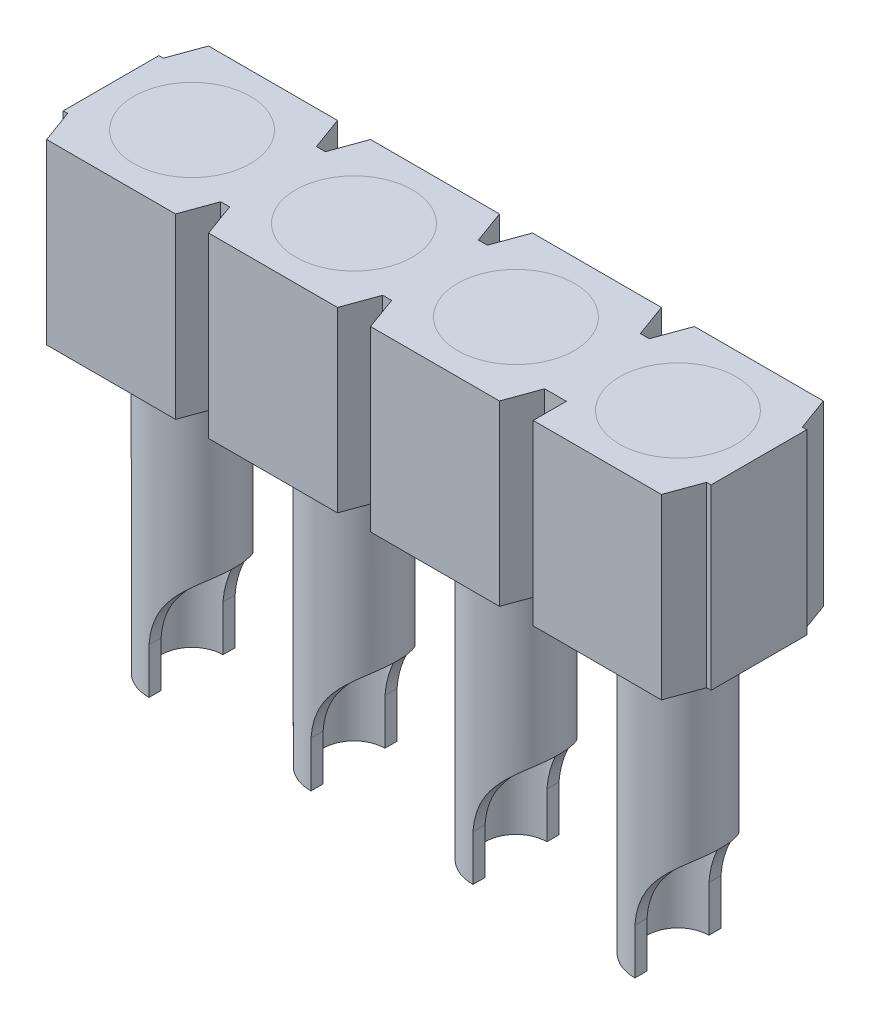
from build123d import *

# Parameters (mm, degrees)
SKETCH1_R              = 0.675
BOSS_EXTRUDE1_DEPTH    = 2.79
CHAMFER3_SIZE          = 0.2
CHAMFER3_SIZE_2        = 0.549495484
SKETCH2_R              = 0.915
CUT_EXTRUDE1_DEPTH     = 0.5
SKETCH3_R              = 0.915
BOSS_EXTRUDE2_DEPTH    = 0.5
SKETCH4_R              = 0.675
BOSS_EXTRUDE3_DEPTH    = 6.87
SKETCH5_R              = 0.485
CUT_EXTRUDE2_DEPTH     = 2.29
CUT_EXTRUDE3_DEPTH     = 5.919573152
LPATTERN1_START        = 2.29
LPATTERN1_OUTLINE_R    = 0.915
LPATTERN1_DEPTH        = 0.5
LPATTERN1_2_OUTLINE_R  = 0.915
LPATTERN1_2_DEPTH      = 0.5
LPATTERN1_3_OUTLINE_R  = 0.675
LPATTERN1_3_DEPTH      = 2.29
LPATTERN1_4_OUTLINE_R  = 0.915
LPATTERN1_4_DEPTH      = 0.5
LPATTERN1_START_2      = -2.29
LPATTERN1_5_OUTLINE_R  = 0.675
LPATTERN1_5_DEPTH      = 4.58
LPATTERN1_START_3      = -4.58
LPATTERN1_6_DEPTH      = 2.29
LPATTERN1_START_4      = -2.814094852
LPATTERN1_7_DEPTH      = 0.524094852
LPATTERN1_START_5      = -3.863768611
LPATTERN1_8_DEPTH      = 1.049673759
LPATTERN1_START_6      = -2
LPATTERN1_9_DEPTH      = 4
LPATTERN1_10_OUTLINE_R = 0.675
LPATTERN1_10_DEPTH     = 4.58
LPATTERN1_11_DEPTH     = 2.29
LPATTERN1_12_DEPTH     = 0.524094852
LPATTERN1_13_DEPTH     = 1.049673759
LPATTERN1_14_DEPTH     = 4
LPATTERN1_15_OUTLINE_R = 0.915
LPATTERN1_15_DEPTH     = 0.5
LPATTERN1_16_OUTLINE_R = 0.675
LPATTERN1_16_DEPTH     = 4.58
LPATTERN1_17_DEPTH     = 2.29
LPATTERN1_18_DEPTH     = 0.524094852
LPATTERN1_19_DEPTH     = 1.049673759
LPATTERN1_20_DEPTH     = 4
SCALE1_SCALE           = 0.7


with BuildPart() as part:
    # Sketch1 → Boss-Extrude1 (new body)
    with BuildSketch(Plane(origin=(0, 0, 0), x_dir=(1, 0, 0), z_dir=(0, 1, 0))):
        Polygon((1, 1.27), (-1, 1.27), (-1, 0.75), (-1.27, 0.75), (-1.27, -0.75), (-1, -0.75), (-1, -1.27), (1, -1.27), (1, -0.75), (1.27, -0.75), (1.27, 0.75), (1, 0.75), align=None)
        with Locations(Location((0, 0, 0), (0, 0, 270))):
            Circle(SKETCH1_R, mode=Mode.SUBTRACT)
    extrude(amount=BOSS_EXTRUDE1_DEPTH)

    # Chamfer3
    # the kernel refuses this chamfer: 0.549495484, 0.2 mm, written as the material it adds along each edge
    with BuildSketch(Plane(origin=(1, 0, -0.75), x_dir=(1, 0, 0), z_dir=(0, 1, 0))) as chamfer3_piece_1_section:
        Polygon((CHAMFER3_SIZE, 0), (0, CHAMFER3_SIZE_2), (0, 0), align=None)
    chamfer3_piece_1 = extrude(amount=2.79, mode=Mode.PRIVATE)
    chamfer3_piece_1 = split(chamfer3_piece_1, bisect_by=Plane(origin=(1, 0, -1.27), z_dir=(0, 0, 1)), keep=Keep.TOP, mode=Mode.PRIVATE)
    add(chamfer3_piece_1)
    with BuildSketch(Plane(origin=(-1, 0, -0.75), x_dir=(0, 0, -1), z_dir=(0, 1, 0))) as chamfer3_piece_2_section:
        Polygon((CHAMFER3_SIZE_2, 0), (0, CHAMFER3_SIZE), (0, 0), align=None)
    chamfer3_piece_2 = extrude(amount=2.79, mode=Mode.PRIVATE)
    chamfer3_piece_2 = split(chamfer3_piece_2, bisect_by=Plane(origin=(-1, 0, -1.27), z_dir=(0, 0, 1)), keep=Keep.TOP, mode=Mode.PRIVATE)
    add(chamfer3_piece_2)
    with BuildSketch(Plane(origin=(-1, 0, 0.75), x_dir=(-1, 0, 0), z_dir=(0, 1, 0))) as chamfer3_piece_3_section:
        Polygon((CHAMFER3_SIZE, 0), (0, CHAMFER3_SIZE_2), (0, 0), align=None)
    chamfer3_piece_3 = extrude(amount=2.79, mode=Mode.PRIVATE)
    chamfer3_piece_3 = split(chamfer3_piece_3, bisect_by=Plane(origin=(-1, 0, 1.27), z_dir=(0, 0, -1)), keep=Keep.TOP, mode=Mode.PRIVATE)
    add(chamfer3_piece_3)
    with BuildSketch(Plane(origin=(1, 0, 0.75), x_dir=(0, 0, 1), z_dir=(0, 1, 0))) as chamfer3_piece_4_section:
        Polygon((CHAMFER3_SIZE_2, 0), (0, CHAMFER3_SIZE), (0, 0), align=None)
    chamfer3_piece_4 = extrude(amount=2.79, mode=Mode.PRIVATE)
    chamfer3_piece_4 = split(chamfer3_piece_4, bisect_by=Plane(origin=(1, 0, 1.27), z_dir=(0, 0, -1)), keep=Keep.TOP, mode=Mode.PRIVATE)
    add(chamfer3_piece_4)

    # Sketch2 → Cut-Extrude1 (cut)
    with BuildSketch(Plane(origin=(0, 2.79, 0), x_dir=(1, 0, 0), z_dir=(0, 1, 0))):
        with Locations(Location((0, 0, 0), (0, 0, 270))):
            Circle(SKETCH2_R)
    extrude(amount=-CUT_EXTRUDE1_DEPTH, mode=Mode.SUBTRACT)

    # LPattern1 3 outline → LPattern1 3 (add)
    with BuildSketch(Plane(origin=(0, 0, 0), x_dir=(1, 0, 0), z_dir=(0, 1, 0))):
        Polygon((1.529264522, 1.27), (1.34, 0.75), (1.27, 0.75), (1.27, -0.75), (1.34, -0.75), (1.529264522, -1.27), (3.550735478, -1.27), (3.74, -0.75), (3.88, -0.75), (4.069264522, -1.27), (6.090735478, -1.27), (6.28, -0.75), (6.62, -0.75), (6.62, -1.27), (8.630735478, -1.27), (8.82, -0.75), (8.89, -0.75), (8.89, 0.75), (8.82, 0.75), (8.630735478, 1.27), (6.609264522, 1.27), (6.42, 0.75), (6.28, 0.75), (6.090735478, 1.27), (4.069264522, 1.27), (3.88, 0.75), (3.74, 0.75), (3.550735478, 1.27), align=None)
        with Locations((2.54, 0)):
            Circle(LPATTERN1_3_OUTLINE_R, mode=Mode.SUBTRACT)
        with Locations((5.08, 0)):
            Circle(LPATTERN1_3_OUTLINE_R, mode=Mode.SUBTRACT)
        with Locations((7.62, 0)):
            Circle(LPATTERN1_3_OUTLINE_R, mode=Mode.SUBTRACT)
    extrude(amount=LPATTERN1_3_DEPTH)

    # LPattern1 4 outline → LPattern1 4 (add)
    with BuildSketch(Plane(origin=(0, 0, 0), x_dir=(1, 0, 0), z_dir=(0, 1, 0)).offset(LPATTERN1_START)):
        Polygon((1.529264522, 1.27), (1.34, 0.75), (1.27, 0.75), (1.27, -0.75), (1.34, -0.75), (1.529264522, -1.27), (3.550735478, -1.27), (3.74, -0.75), (3.88, -0.75), (4.069264522, -1.27), (6.090735478, -1.27), (6.28, -0.75), (6.62, -0.75), (6.62, -1.27), (8.630735478, -1.27), (8.82, -0.75), (8.89, -0.75), (8.89, 0.75), (8.82, 0.75), (8.630735478, 1.27), (6.609264522, 1.27), (6.42, 0.75), (6.28, 0.75), (6.090735478, 1.27), (4.069264522, 1.27), (3.88, 0.75), (3.74, 0.75), (3.550735478, 1.27), align=None)
        with Locations((2.54, 0)):
            Circle(LPATTERN1_4_OUTLINE_R, mode=Mode.SUBTRACT)
        with Locations((5.08, 0)):
            Circle(LPATTERN1_4_OUTLINE_R, mode=Mode.SUBTRACT)
        with Locations((7.62, 0)):
            Circle(LPATTERN1_4_OUTLINE_R, mode=Mode.SUBTRACT)
    extrude(amount=LPATTERN1_4_DEPTH)


with BuildPart() as body_2:
    # Sketch3 → Boss-Extrude2 (new body)
    with BuildSketch(Plane(origin=(0, 2.79, 0), x_dir=(1, 0, 0), z_dir=(0, 1, 0))):
        with Locations(Location((0, 0, 0), (0, 0, 270))):
            Circle(SKETCH3_R)
    extrude(amount=-BOSS_EXTRUDE2_DEPTH)


with BuildPart() as body_3:
    # Sketch4 → Boss-Extrude3 (new body)
    with BuildSketch(Plane.XZ.offset(-2.29)):
        with Locations(Location((0, 0, 0), (0, 0, 90))):
            Circle(SKETCH4_R)
    extrude(amount=BOSS_EXTRUDE3_DEPTH)

    # Sketch5 → Cut-Extrude2 (cut)
    with BuildSketch(Plane.XZ.offset(4.58)):
        with Locations(Location((0, 0, 0), (0, 0, 270))):
            Circle(SKETCH5_R)
    extrude(amount=-CUT_EXTRUDE2_DEPTH, mode=Mode.SUBTRACT)

    # Sketch6 → Cut-Extrude3 (cut, symmetric)
    with BuildSketch(Plane.XY):
        with BuildLine():
            Line((0.675, -4.58), (0, -4.58))
            Line((0, -4.58), (0, -3.863768511))
            ThreePointArc((0, -3.863768511), (0.203322314, -3.25264809), (0.675, -2.814095593))
            Line((0.675, -2.814095593), (0.675, -4.58))
        make_face()
    extrude(amount=CUT_EXTRUDE3_DEPTH, both=True, mode=Mode.SUBTRACT)


with BuildPart() as body_4:
    # LPattern1: read off the stored shape, not the designer's step
    # LPattern1 outline → LPattern1 (new body)
    with BuildSketch(Plane(origin=(0, 0, 0), x_dir=(1, 0, 0), z_dir=(0, 1, 0)).offset(LPATTERN1_START)):
        with Locations((7.62, 0)):
            Circle(LPATTERN1_OUTLINE_R)
    extrude(amount=LPATTERN1_DEPTH)


with BuildPart() as body_5:
    # LPattern1 2 outline → LPattern1 2 (new body)
    with BuildSketch(Plane(origin=(0, 0, 0), x_dir=(1, 0, 0), z_dir=(0, 1, 0)).offset(LPATTERN1_START)):
        with Locations((2.54, 0)):
            Circle(LPATTERN1_2_OUTLINE_R)
    extrude(amount=LPATTERN1_2_DEPTH)


with BuildPart() as body_6:
    # LPattern1 5 outline → LPattern1 5 (new body)
    with BuildSketch(Plane(origin=(0, 0, 0), x_dir=(1, 0, 0), z_dir=(0, 1, 0)).offset(LPATTERN1_START_2)):
        with Locations((5.08, 0)):
            Circle(LPATTERN1_5_OUTLINE_R)
    extrude(amount=LPATTERN1_5_DEPTH)

    # LPattern1 6 outline → LPattern1 6 (add)
    with BuildSketch(Plane(origin=(0, 0, 0), x_dir=(1, 0, 0), z_dir=(0, 1, 0)).offset(LPATTERN1_START_3)):
        with BuildLine():
            Line((5.08, 0.485), (5.08, 0.675))
            ThreePointArc((5.08, 0.675), (4.405, 0), (5.08, -0.675))
            Line((5.08, -0.675), (5.08, -0.485))
            ThreePointArc((5.08, -0.485), (4.595, 0), (5.08, 0.485))
        make_face()
    extrude(amount=LPATTERN1_6_DEPTH)

    # LPattern1 7 outline → LPattern1 7 (add)
    with BuildSketch(Plane(origin=(0, 0, 0), x_dir=(1, 0, 0), z_dir=(0, 1, 0)).offset(LPATTERN1_START_4)):
        with BuildLine():
            ThreePointArc((5.08, -0.675), (5.755, 0), (5.08, 0.675))
            Line((5.08, 0.675), (5.08, 0.485))
            ThreePointArc((5.08, 0.485), (5.565, 0), (5.08, -0.485))
            Line((5.08, -0.485), (5.08, -0.675))
        make_face()
    extrude(amount=LPATTERN1_7_DEPTH)

    # LPattern1 8 outline → LPattern1 8 (add)
    with BuildSketch(Plane(origin=(0, 0, 0), x_dir=(1, 0, 0), z_dir=(0, 1, 0)).offset(LPATTERN1_START_5)):
        with BuildLine():
            ThreePointArc((5.08, 0.485), (5.565, 0), (5.08, -0.485))
            Line((5.08, -0.485), (5.08, -0.675))
            ThreePointArc((5.08, -0.675), (5.755, 0), (5.08, 0.675))
            Line((5.08, 0.675), (5.08, 0.485))
        make_face()
    extrude(amount=LPATTERN1_8_DEPTH)

    # LPattern1 9 outline → LPattern1 9 (cut)
    with BuildSketch(Plane.XY.offset(LPATTERN1_START_6)):
        with BuildLine():
            Line((7, -2.13622338), (5.755154284, -2.814011576))
            ThreePointArc((5.755154284, -2.814011576), (5.283369826, -3.25257421), (5.08, -3.863768511))
            Line((5.08, -3.863768511), (7, -3.863768611))
            Line((7, -3.863768611), (7, -2.13622338))
        make_face()
    extrude(amount=LPATTERN1_9_DEPTH, mode=Mode.SUBTRACT)


with BuildPart() as body_7:
    # LPattern1 10 outline → LPattern1 10 (new body)
    with BuildSketch(Plane(origin=(0, 0, 0), x_dir=(1, 0, 0), z_dir=(0, 1, 0)).offset(LPATTERN1_START_2)):
        with Locations((7.62, 0)):
            Circle(LPATTERN1_10_OUTLINE_R)
    extrude(amount=LPATTERN1_10_DEPTH)

    # LPattern1 11 outline → LPattern1 11 (add)
    with BuildSketch(Plane(origin=(0, 0, 0), x_dir=(1, 0, 0), z_dir=(0, 1, 0)).offset(LPATTERN1_START_3)):
        with BuildLine():
            Line((7.62, 0.485), (7.62, 0.675))
            ThreePointArc((7.62, 0.675), (6.945, 0), (7.62, -0.675))
            Line((7.62, -0.675), (7.62, -0.485))
            ThreePointArc((7.62, -0.485), (7.135, 0), (7.62, 0.485))
        make_face()
    extrude(amount=LPATTERN1_11_DEPTH)

    # LPattern1 12 outline → LPattern1 12 (add)
    with BuildSketch(Plane(origin=(0, 0, 0), x_dir=(1, 0, 0), z_dir=(0, 1, 0)).offset(LPATTERN1_START_4)):
        with BuildLine():
            ThreePointArc((7.62, -0.675), (8.295, 0), (7.62, 0.675))
            Line((7.62, 0.675), (7.62, 0.485))
            ThreePointArc((7.62, 0.485), (8.105, 0), (7.62, -0.485))
            Line((7.62, -0.485), (7.62, -0.675))
        make_face()
    extrude(amount=LPATTERN1_12_DEPTH)

    # LPattern1 13 outline → LPattern1 13 (add)
    with BuildSketch(Plane(origin=(0, 0, 0), x_dir=(1, 0, 0), z_dir=(0, 1, 0)).offset(LPATTERN1_START_5)):
        with BuildLine():
            ThreePointArc((7.62, 0.485), (8.105, 0), (7.62, -0.485))
            Line((7.62, -0.485), (7.62, -0.675))
            ThreePointArc((7.62, -0.675), (8.295, 0), (7.62, 0.675))
            Line((7.62, 0.675), (7.62, 0.485))
        make_face()
    extrude(amount=LPATTERN1_13_DEPTH)

    # LPattern1 14 outline → LPattern1 14 (cut)
    with BuildSketch(Plane.XY.offset(LPATTERN1_START_6)):
        with BuildLine():
            Line((10, -1.885764576), (8.295154284, -2.814011576))
            ThreePointArc((8.295154284, -2.814011576), (7.823369826, -3.25257421), (7.62, -3.863768511))
            Line((7.62, -3.863768511), (10, -3.863768611))
            Line((10, -3.863768611), (10, -1.885764576))
        make_face()
    extrude(amount=LPATTERN1_14_DEPTH, mode=Mode.SUBTRACT)


with BuildPart() as body_8:
    # LPattern1 15 outline → LPattern1 15 (new body)
    with BuildSketch(Plane(origin=(0, 0, 0), x_dir=(1, 0, 0), z_dir=(0, 1, 0)).offset(LPATTERN1_START)):
        with Locations((5.08, 0)):
            Circle(LPATTERN1_15_OUTLINE_R)
    extrude(amount=LPATTERN1_15_DEPTH)


with BuildPart() as body_9:
    # LPattern1 16 outline → LPattern1 16 (new body)
    with BuildSketch(Plane(origin=(0, 0, 0), x_dir=(1, 0, 0), z_dir=(0, 1, 0)).offset(LPATTERN1_START_2)):
        with Locations((2.54, 0)):
            Circle(LPATTERN1_16_OUTLINE_R)
    extrude(amount=LPATTERN1_16_DEPTH)

    # LPattern1 17 outline → LPattern1 17 (add)
    with BuildSketch(Plane(origin=(0, 0, 0), x_dir=(1, 0, 0), z_dir=(0, 1, 0)).offset(LPATTERN1_START_3)):
        with BuildLine():
            Line((2.54, 0.485), (2.54, 0.675))
            ThreePointArc((2.54, 0.675), (1.865, 0), (2.54, -0.675))
            Line((2.54, -0.675), (2.54, -0.485))
            ThreePointArc((2.54, -0.485), (2.055, 0), (2.54, 0.485))
        make_face()
    extrude(amount=LPATTERN1_17_DEPTH)

    # LPattern1 18 outline → LPattern1 18 (add)
    with BuildSketch(Plane(origin=(0, 0, 0), x_dir=(1, 0, 0), z_dir=(0, 1, 0)).offset(LPATTERN1_START_4)):
        with BuildLine():
            ThreePointArc((2.54, -0.675), (3.215, 0), (2.54, 0.675))
            Line((2.54, 0.675), (2.54, 0.485))
            ThreePointArc((2.54, 0.485), (3.025, 0), (2.54, -0.485))
            Line((2.54, -0.485), (2.54, -0.675))
        make_face()
    extrude(amount=LPATTERN1_18_DEPTH)

    # LPattern1 19 outline → LPattern1 19 (add)
    with BuildSketch(Plane(origin=(0, 0, 0), x_dir=(1, 0, 0), z_dir=(0, 1, 0)).offset(LPATTERN1_START_5)):
        with BuildLine():
            ThreePointArc((2.54, 0.485), (3.025, 0), (2.54, -0.485))
            Line((2.54, -0.485), (2.54, -0.675))
            ThreePointArc((2.54, -0.675), (3.215, 0), (2.54, 0.675))
            Line((2.54, 0.675), (2.54, 0.485))
        make_face()
    extrude(amount=LPATTERN1_19_DEPTH)

    # LPattern1 20 outline → LPattern1 20 (cut)
    with BuildSketch(Plane.XY.offset(LPATTERN1_START_6)):
        with BuildLine():
            Line((5, -1.842206523), (3.215154284, -2.814011576))
            ThreePointArc((3.215154284, -2.814011576), (2.743369826, -3.25257421), (2.54, -3.863768511))
            Line((2.54, -3.863768511), (5, -3.863768611))
            Line((5, -3.863768611), (5, -1.842206523))
        make_face()
    extrude(amount=LPATTERN1_20_DEPTH, mode=Mode.SUBTRACT)


with BuildPart() as body_9_1:
    # Scale1: scaled about (0, 0, 0)
    add(body_9.part.scale(SCALE1_SCALE))


with BuildPart() as body_8_1:
    # Scale1: scaled about (0, 0, 0)
    add(body_8.part.scale(SCALE1_SCALE))


with BuildPart() as body_7_1:
    # Scale1: scaled about (0, 0, 0)
    add(body_7.part.scale(SCALE1_SCALE))


with BuildPart() as body_6_1:
    # Scale1: scaled about (0, 0, 0)
    add(body_6.part.scale(SCALE1_SCALE))


with BuildPart() as part_1:
    # Scale1: scaled about (0, 0, 0)
    add(part.part.scale(SCALE1_SCALE))


with BuildPart() as body_5_1:
    # Scale1: scaled about (0, 0, 0)
    add(body_5.part.scale(SCALE1_SCALE))


with BuildPart() as body_3_1:
    # Scale1: scaled about (0, 0, 0)
    add(body_3.part.scale(SCALE1_SCALE))


with BuildPart() as body_4_1:
    # Scale1: scaled about (0, 0, 0)
    add(body_4.part.scale(SCALE1_SCALE))


with BuildPart() as body_2_1:
    # Scale1: scaled about (0, 0, 0)
    add(body_2.part.scale(SCALE1_SCALE))


solid = Compound([body_9_1.part, body_8_1.part, body_7_1.part, body_6_1.part, part_1.part, body_5_1.part, body_3_1.part, body_4_1.part, body_2_1.part])
